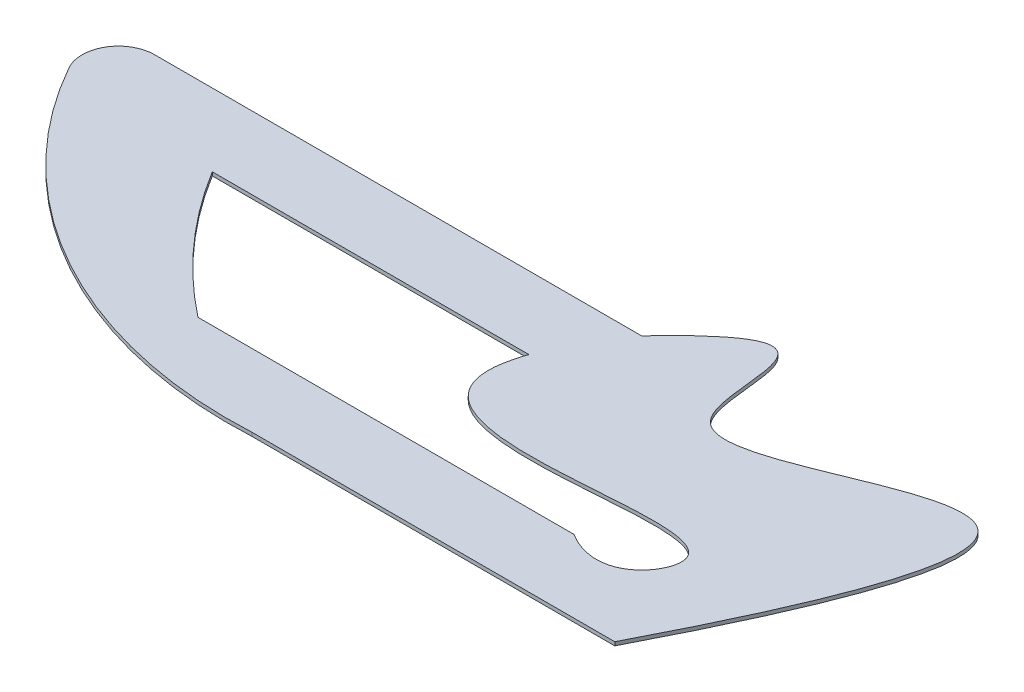
from build123d import *

# Parameters (mm, degrees)
BOSS_EXTRUDE1_DEPTH = 500


with BuildPart() as part:
    # Sketch1 → Boss-Extrude1 (new body)
    with BuildSketch(Plane(origin=(0, 0, 0), x_dir=(1, 0, 0), z_dir=(0, 1, 0))):
        with BuildLine():
            Line((48437.594420592, 2512.922713511), (98437.594420592, 2512.922713511))
            add(Edge.make_bspline(
                [(63779.776532113, 40868.64242421), (81155.109551936, 59417.478825497), (61765.461836014, 3316.612432219), (133877.924958022, 71175.93390137), (98437.594420592, 2512.922713511)],
                knots=[0, 0, 0, 0, 0.353580897, 1, 1, 1, 1], degree=3))
            Line((63779.776532113, 40868.64242421), (-3324.611014146, 40868.64242421))
            ThreePointArc((-3324.611014146, 40868.64242421), (-7639.144014473, 38395.45958995), (-7685.425433099, 33422.564419842))
            ThreePointArc((-7685.425433099, 33422.564419842), (15963.851948551, 9956.398204418), (48437.594420592, 2512.922713511))
        make_face()
        with BuildLine():
            Line((30997.317260126, 12512.922713511), (82807.799668839, 12512.922713511))
            add(Edge.make_bspline(
                [(58250.565775761, 30868.64242421), (50714.598869874, 9071.352646299), (106640.442885578, 30970.052669296), (89500.838888093, 8357.39622597), (82807.799668839, 12512.922713511)],
                knots=[0, 0, 0, 0, 0.742820626, 1, 1, 1, 1], degree=3))
            Line((58250.565775761, 30868.64242421), (14612.805729166, 30868.64242421))
            ThreePointArc((14612.805729166, 30868.64242421), (21983.059056214, 20957.054409832), (30997.317260126, 12512.922713511))
        make_face(mode=Mode.SUBTRACT)
    extrude(amount=BOSS_EXTRUDE1_DEPTH)


solid = part.part
